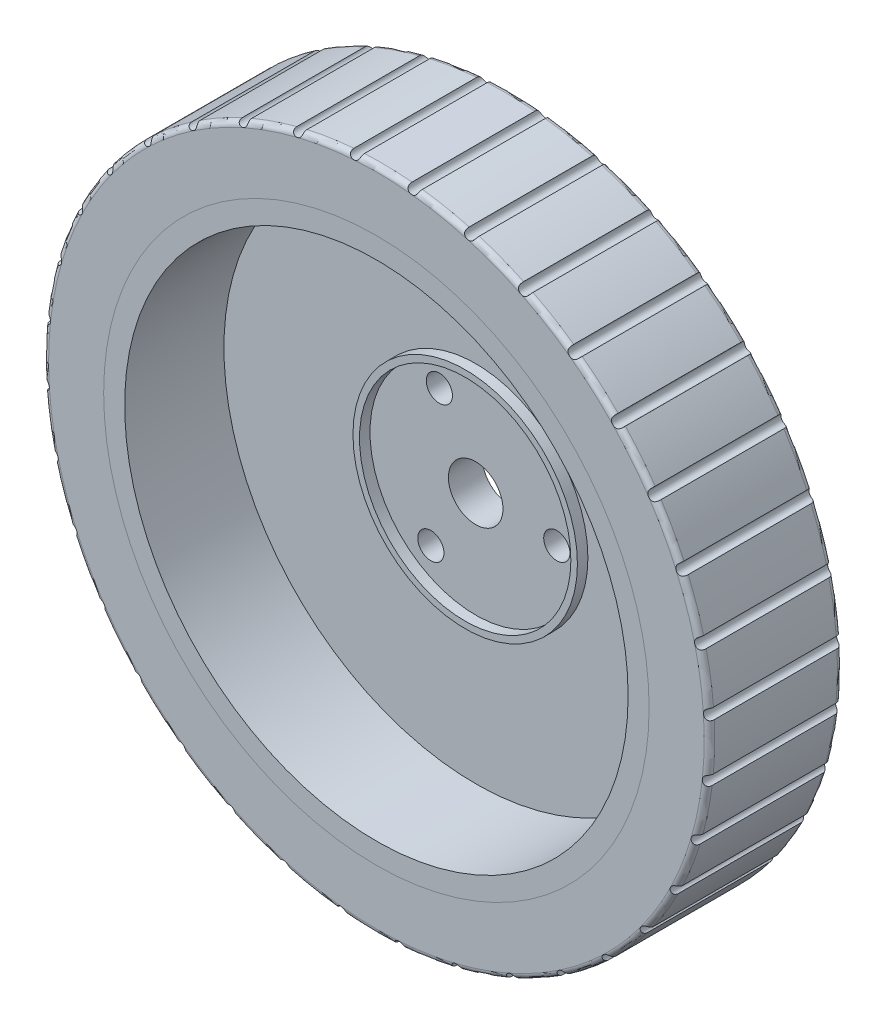
from build123d import *
from OCP.BRepAlgoAPI import BRepAlgoAPI_Cut
from OCP.TopTools import TopTools_ListOfShape

# Parameters (mm, degrees)
SKETCH1_R               = 63.5
SKETCH1_R_2             = 52
BOSS_EXTRUDE1_DEPTH     = 25.4
FILLET1_R               = 1
SKETCH3_R               = 1
CUT_EXTRUDE3_DEPTH      = 94.325559268
SKETCH4_R               = 52
SKETCH4_R_2             = 48
BOSS_EXTRUDE2_DEPTH     = 25.4
SKETCH5_R               = 48
BOSS_EXTRUDE3_DEPTH     = 6.47
SKETCH7_R               = 21.4
SKETCH7_R_2             = 20.15
BOSS_EXTRUDE4_DEPTH     = 2
CUT_EXTRUDE4_DEPTH      = 94.325559363
CUT_EXTRUDE4_DEPTH_BACK = 94.325559363
SKETCH8_R               = 5.2
SKETCH8_R_2             = 2.5
CUT_EXTRUDE7_DEPTH      = 2
CUT_EXTRUDE7_DEPTH_BACK = 2.47


with BuildPart() as part:
    # Sketch1 → Boss-Extrude1 (new body)
    with BuildSketch(Plane.XY):
        Circle(SKETCH1_R)
        Circle(SKETCH1_R_2, mode=Mode.SUBTRACT)
    extrude(amount=BOSS_EXTRUDE1_DEPTH)

    # Fillet1
    fillet1_edges = [part.edges().sort_by_distance(p)[0] for p in [
        (-63.5, 0, 0),
        (-63.5, 0, 25.4),
    ]]
    fillet(fillet1_edges, radius=FILLET1_R)


with BuildPart() as cut_extrude3_tool:
    # Sketch3 → Cut-Extrude3 (new, through all)
    with BuildSketch(Plane.XY):
        with Locations((-60.995666922, 17.657253943)):
            Circle(SKETCH3_R)
        with Locations((-57.002855715, 27.980786986)):
            Circle(SKETCH3_R)
        with Locations((-51.278041582, 37.454137976)):
            Circle(SKETCH3_R)
        with Locations((-43.995170104, 45.789463936)):
            Circle(SKETCH3_R)
        with Locations((-35.375527644, 52.733500205)):
            Circle(SKETCH3_R)
        with Locations((-25.681017678, 58.075255755)):
            Circle(SKETCH3_R)
        with Locations((-15.206202985, 61.652424046)):
            Circle(SKETCH3_R)
        with Locations((-4.26935551, 63.35631463)):
            Circle(SKETCH3_R)
        with Locations((6.797214173, 63.135155654)):
            Circle(SKETCH3_R)
        with Locations((17.657253943, 60.995666922)):
            Circle(SKETCH3_R)
        with Locations((27.980786986, 57.002855715)):
            Circle(SKETCH3_R)
        with Locations((37.454137976, 51.278041582)):
            Circle(SKETCH3_R)
        with Locations((45.789463936, 43.995170104)):
            Circle(SKETCH3_R)
        with Locations((52.733500205, 35.375527644)):
            Circle(SKETCH3_R)
        with Locations((58.075255755, 25.681017678)):
            Circle(SKETCH3_R)
        with Locations((61.652424046, 15.206202985)):
            Circle(SKETCH3_R)
        with Locations((63.35631463, 4.26935551)):
            Circle(SKETCH3_R)
        with Locations((63.135155654, -6.797214173)):
            Circle(SKETCH3_R)
        with Locations((60.995666922, -17.657253943)):
            Circle(SKETCH3_R)
        with Locations((57.002855715, -27.980786986)):
            Circle(SKETCH3_R)
        with Locations((51.278041582, -37.454137976)):
            Circle(SKETCH3_R)
        with Locations((43.995170104, -45.789463936)):
            Circle(SKETCH3_R)
        with Locations((35.375527644, -52.733500205)):
            Circle(SKETCH3_R)
        with Locations((25.681017678, -58.075255755)):
            Circle(SKETCH3_R)
        with Locations((15.206202985, -61.652424046)):
            Circle(SKETCH3_R)
        with Locations((4.26935551, -63.35631463)):
            Circle(SKETCH3_R)
        with Locations((-6.797214173, -63.135155654)):
            Circle(SKETCH3_R)
        with Locations((-17.657253943, -60.995666922)):
            Circle(SKETCH3_R)
        with Locations((-27.980786986, -57.002855715)):
            Circle(SKETCH3_R)
        with Locations((-37.454137976, -51.278041582)):
            Circle(SKETCH3_R)
        with Locations((-45.789463936, -43.995170104)):
            Circle(SKETCH3_R)
        with Locations((-52.733500205, -35.375527644)):
            Circle(SKETCH3_R)
        with Locations((-58.075255755, -25.681017678)):
            Circle(SKETCH3_R)
        with Locations((-61.652424046, -15.206202985)):
            Circle(SKETCH3_R)
        with Locations((-63.35631463, -4.26935551)):
            Circle(SKETCH3_R)
        with Locations((-63.135155654, 6.797214173)):
            Circle(SKETCH3_R)
    extrude(amount=CUT_EXTRUDE3_DEPTH)


with BuildPart() as part_1:
    add(part.part)

    # Cut-Extrude3: cut by cut_extrude3_tool, with a tolerance
    cut_extrude3_stock = TopTools_ListOfShape()
    cut_extrude3_stock.Append(part_1.part.wrapped)
    cut_extrude3_tools = TopTools_ListOfShape()
    cut_extrude3_tools.Append(cut_extrude3_tool.part.wrapped)
    cut_extrude3_cut = BRepAlgoAPI_Cut()
    cut_extrude3_cut.SetArguments(cut_extrude3_stock)
    cut_extrude3_cut.SetTools(cut_extrude3_tools)
    cut_extrude3_cut.SetFuzzyValue(0.00001)
    cut_extrude3_cut.Build()
    add(Compound.cast(cut_extrude3_cut.Shape()).solids(), mode=Mode.REPLACE)


with BuildPart() as body_2:
    # Sketch4 → Boss-Extrude2 (new body)
    with BuildSketch(Plane.XY):
        Circle(SKETCH4_R)
        Circle(SKETCH4_R_2, mode=Mode.SUBTRACT)
    extrude(amount=BOSS_EXTRUDE2_DEPTH)


with BuildPart() as body_3:
    # Sketch5 → Boss-Extrude3 (new body)
    with BuildSketch(Plane.XY):
        Circle(SKETCH5_R)
    extrude(amount=BOSS_EXTRUDE3_DEPTH)

    # Sketch8 → Cut-Extrude4 (cut, two sides: drawn at the far end of the back side and taken through both)
    with BuildSketch(Plane.XY.offset(-CUT_EXTRUDE4_DEPTH_BACK)):
        Circle(SKETCH8_R)
        with Locations((-6.9259938, 13.866528401)):
            Circle(SKETCH8_R_2)
        with Locations((15.471762757, -0.935177623)):
            Circle(SKETCH8_R_2)
        with Locations((-8.545768957, -12.931350777)):
            Circle(SKETCH8_R_2)
    extrude(amount=CUT_EXTRUDE4_DEPTH + CUT_EXTRUDE4_DEPTH_BACK, mode=Mode.SUBTRACT)

    # Sketch10 → Cut-Extrude7 (cut, two sides: drawn at the far end of the back side and taken through both)
    with BuildSketch(Plane.XY.offset(-CUT_EXTRUDE7_DEPTH_BACK)):
        with BuildLine():
            Line((5.169992808, 20.353652605), (11.324746151, 44.58419142))
            ThreePointArc((11.324746151, 44.58419142), (-4.606911149, 45.768726983), (-19.982906974, 41.432878597))
            Line((-19.982906974, 41.432878597), (-9.122631445, 18.915009794))
            ThreePointArc((-9.122631445, 18.915009794), (-2.10315509, 20.89441884), (5.169992808, 20.353652605))
        make_face()
        with BuildLine():
            Line((20.955089579, 1.372669203), (45.901624792, 3.006799207))
            ThreePointArc((45.901624792, 3.006799207), (42.105032203, 18.524747317), (33.229951327, 31.808337505))
            Line((33.229951327, 31.808337505), (15.170195171, 14.521197557))
            ThreePointArc((15.170195171, 14.521197557), (19.221862528, 8.456949862), (20.955089579, 1.372669203))
        make_face()
        with BuildLine():
            Line((7.780964789, -19.505296382), (17.044018109, -42.725887313))
            ThreePointArc((17.044018109, -42.725887313), (30.629252148, -34.319803508), (40.520146339, -21.774244894))
            Line((40.520146339, -21.774244894), (18.498327676, -9.940416147))
            ThreePointArc((18.498327676, -9.940416147), (13.982919459, -15.667736384), (7.780964789, -19.505296382))
        make_face()
        with BuildLine():
            Line((-16.146188874, -13.427605328), (-35.367842296, -29.412849766))
            ThreePointArc((-35.367842296, -29.412849766), (-23.175113326, -39.735552372), (-8.18712366, -45.265560928))
            Line((-8.18712366, -45.265560928), (-3.737599932, -20.664712598))
            ThreePointArc((-3.737599932, -20.664712598), (-10.57994304, -18.140143474), (-16.146188874, -13.427605328))
        make_face()
        with BuildLine():
            Line((-17.759858302, 11.206579902), (-38.902546757, 24.547746452))
            ThreePointArc((-38.902546757, 24.547746452), (-44.952259877, 9.76188158), (-45.580067031, -6.20141028))
            Line((-45.580067031, -6.20141028), (-20.808291471, -2.831078606))
            ThreePointArc((-20.808291471, -2.831078606), (-20.521683857, 4.456511156), (-17.759858302, 11.206579902))
        make_face()
    extrude(amount=CUT_EXTRUDE7_DEPTH + CUT_EXTRUDE7_DEPTH_BACK, mode=Mode.SUBTRACT)


with BuildPart() as body_4:
    # Sketch7 → Boss-Extrude4 (new body)
    with BuildSketch(Plane.XY.offset(6.47)):
        Circle(SKETCH7_R)
        Circle(SKETCH7_R_2, mode=Mode.SUBTRACT)
    extrude(amount=BOSS_EXTRUDE4_DEPTH)


solid = Compound([part_1.part, body_2.part, body_3.part, body_4.part])
